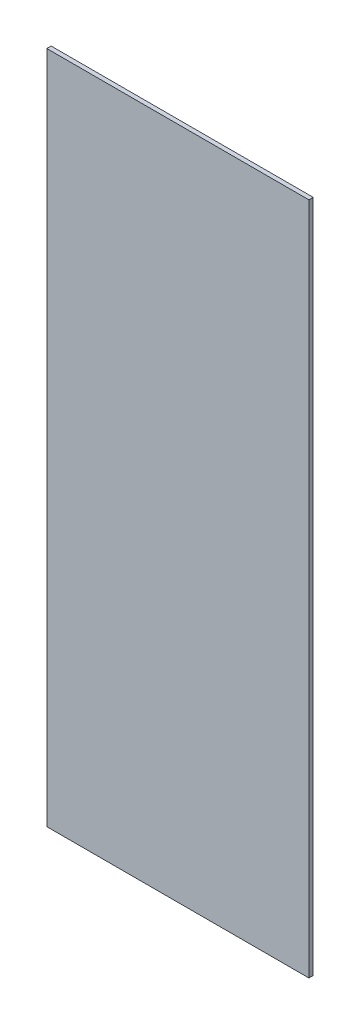
from build123d import *

# Parameters (mm, degrees)
TABAN_FLAN_1_DEPTH         = 10
KES_EKSTR_ZYON1_DEPTH      = 6203.134229441
KES_EKSTR_ZYON1_DEPTH_BACK = 6203.134229441
IZIM2_W                    = 906
IZIM2_H                    = 514.622046042
KES_EKSTR_ZYON2_DEPTH      = 6203.134229441
KES_EKSTR_ZYON2_DEPTH_BACK = 6203.134229441
IZIM3_W                    = 1175.952493344
IZIM3_H                    = 433.266784627


# Sheet-metal steps are written as plain solids
with BuildPart() as part:
    # Çizim1 → Taban-Flanş1 (new body)
    with BuildSketch(Plane.XY):
        Polygon((0, 0), (0, -6015), (606, -6015), (606, -4460), (1512, -4460), (1512, 0), align=None)
    extrude(amount=-TABAN_FLAN_1_DEPTH)

    # Çizim2 → Kes-Ekstrüzyon1 (cut, two sides: drawn at the far end of the back side and taken through both)
    with BuildSketch(Plane.XY.offset(-KES_EKSTR_ZYON1_DEPTH_BACK)):
        Polygon((1512, -4457), (1512, 0), (0, 0), (0, -4457), (606, -4457), align=None)
        with Locations((1059, -4717.311023021)):
            Rectangle(IZIM2_W, IZIM2_H)
    extrude(amount=KES_EKSTR_ZYON1_DEPTH + KES_EKSTR_ZYON1_DEPTH_BACK, mode=Mode.SUBTRACT)

    # Çizim3 → Kes-Ekstrüzyon2 (cut, two sides: drawn at the far end of the back side and taken through both)
    with BuildSketch(Plane.XY.offset(-KES_EKSTR_ZYON2_DEPTH_BACK)):
        with Locations((1193.976246672, -4355.859551482)):
            Rectangle(IZIM3_W, IZIM3_H)
    extrude(amount=KES_EKSTR_ZYON2_DEPTH + KES_EKSTR_ZYON2_DEPTH_BACK, mode=Mode.SUBTRACT)


solid = part.part
